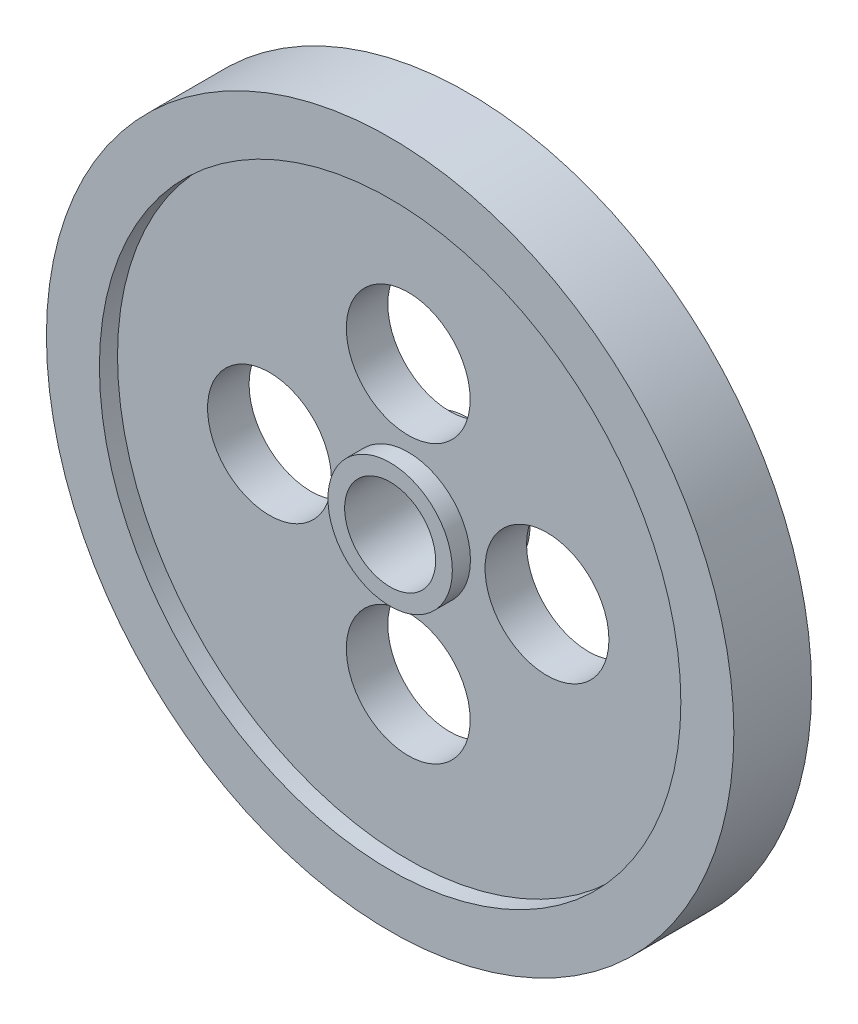
from build123d import *

# Parameters (mm, degrees)
SKETCH1_R           = 24.66826923
SKETCH1_R_2         = 3.2639
BOSS_EXTRUDE1_DEPTH = 2.79
SKETCH2_R           = 20.865
SKETCH2_R_2         = 4.465
CUT_EXTRUDE1_DEPTH  = 1.3
SKETCH3_R           = 4.445
CUT_EXTRUDE2_DEPTH  = 36.147765414


with BuildPart() as part:
    # Sketch1 → Boss-Extrude1 (new, symmetric)
    with BuildSketch(Plane.XY):
        Circle(SKETCH1_R)
        Circle(SKETCH1_R_2, mode=Mode.SUBTRACT)
    extrude(amount=BOSS_EXTRUDE1_DEPTH, both=True)

    # Sketch2 → Cut-Extrude1 (cut)
    with BuildSketch(Plane.XY.offset(2.79)):
        Circle(SKETCH2_R)
        Circle(SKETCH2_R_2, mode=Mode.SUBTRACT)
    cut_extrude1 = extrude(amount=-CUT_EXTRUDE1_DEPTH, mode=Mode.SUBTRACT)

    # Sketch3 → Cut-Extrude2 (cut, through all)
    with BuildSketch(Plane.XY.offset(1.49)):
        with Locations((0, 9.9568)):
            Circle(SKETCH3_R)
        with Locations((9.9568, 0)):
            Circle(SKETCH3_R)
        with Locations((0, -9.9568)):
            Circle(SKETCH3_R)
        with Locations((-9.9568, 0)):
            Circle(SKETCH3_R)
    extrude(amount=-CUT_EXTRUDE2_DEPTH, mode=Mode.SUBTRACT)

    # Mirror1: Cut-Extrude1 across plane
    add(cut_extrude1.mirror(Plane.XY), mode=Mode.SUBTRACT)


solid = part.part
